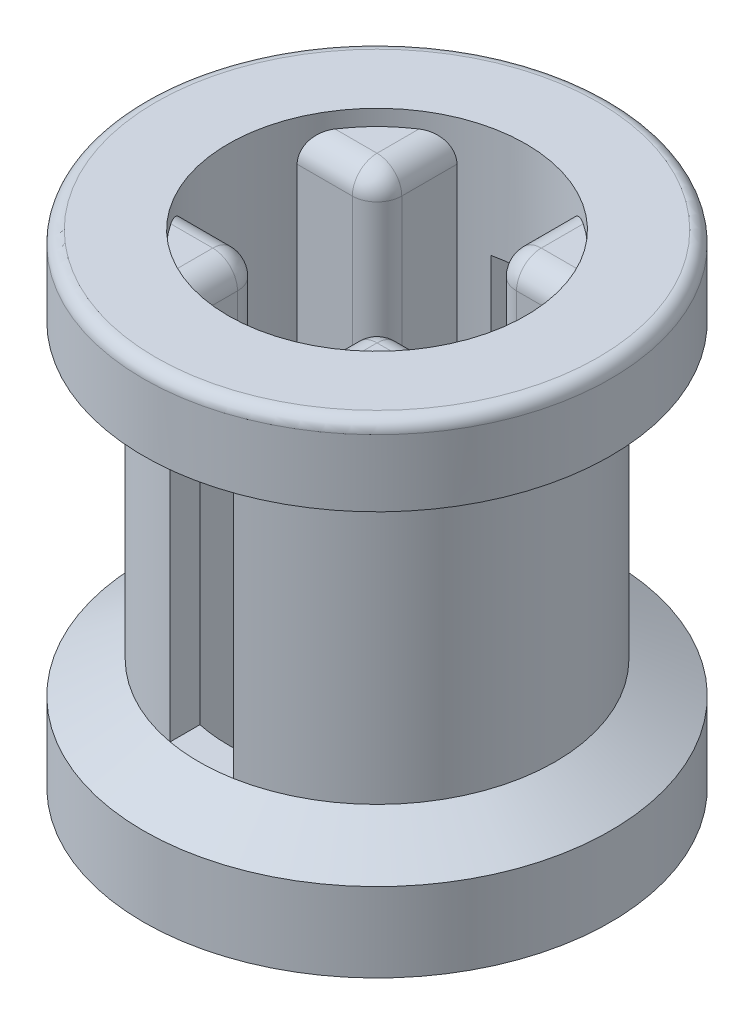
from build123d import *
from build123d.topology import SkipClean

# Parameters (mm, degrees)
SKETCH2_R                = 2.3876
CUT_EXTRUDE1_DEPTH       = 10.385549185
FILLET1_R                = 0.1984375
CUT_EXTRUDE2_DEPTH       = 10.385549265
CUT_EXTRUDE2_DEPTH_BACK  = 10.385549265
SKETCH3_W                = 1.016
SKETCH3_H                = 4.18947027
BOSS_EXTRUDE1_DEPTH      = 7.747
FILLET2_R                = 0.396875
CIRPATTERN1_COUNT        = 4
FILLET2_OF_CIRPATTERN1_R = 0.396875
SKETCH5_R                = 2.3876
CUT_EXTRUDE3_DEPTH       = 0.254
CUT_EXTRUDE4_START       = -0.254
SKETCH6_R                = 2.3876
CUT_EXTRUDE4_DEPTH       = 0.254
FILLET3_R                = 0.396875


with BuildPart() as part:
    # Sketch1 → Base-Revolve (revolve)
    with BuildSketch(Plane.XY, mode=Mode.PRIVATE) as base_revolve_sk:
        Polygon((0, 7.747), (3.7465, 7.747), (3.7465, 6.477), (2.8575, 5.963735611), (2.8575, 1.783264389), (3.7465, 1.27), (3.7465, 0), (0, 0), align=None)
    revolve(base_revolve_sk.sketch.rotate(Axis((0, 0, 0), (0, 1, 0)), 90), axis=Axis((0, 0, 0), (0, 1, 0)))

    # Sketch2 → Cut-Extrude1 (cut, through all)
    with BuildSketch(Plane(origin=(0, 7.747, 0), x_dir=(-1, 0, 0), z_dir=(0, 1, 0))):
        with Locations(Location((0, 0, 0), (0, 0, 90))):
            Circle(SKETCH2_R)
    extrude(amount=-CUT_EXTRUDE1_DEPTH, mode=Mode.SUBTRACT)

    # Fillet1
    fillet1_edges = [part.edges().sort_by_distance(p)[0] for p in [
        (0, 7.747, 3.7465),
    ]]
    fillet(fillet1_edges, radius=FILLET1_R)

    # Sketch3 → Cut-Extrude2 (cut, two sides: drawn at the far end of the back side and taken through both)
    with BuildSketch(Plane.XY.offset(-CUT_EXTRUDE2_DEPTH_BACK)):
        with Locations((0, 3.877999524)):
            Rectangle(SKETCH3_W, SKETCH3_H)
    extrude(amount=CUT_EXTRUDE2_DEPTH + CUT_EXTRUDE2_DEPTH_BACK, mode=Mode.SUBTRACT)

    # Sketch4 → Boss-Extrude1 (add, through all)
    with BuildSketch(Plane(origin=(0, 7.747, 0), x_dir=(-1, 0, 0), z_dir=(0, 1, 0))):
        with BuildLine():
            Line((2.202919244, -0.92075), (0.92075, -0.92075))
            Line((0.92075, -0.92075), (0.92075, -2.202919244))
            ThreePointArc((0.92075, -2.202919244), (1.688288151, -1.688288151), (2.202919244, -0.92075))
        make_face()
    boss_extrude1 = extrude(amount=-BOSS_EXTRUDE1_DEPTH)

    # Fillet2
    fillet2_edges = [part.edges().sort_by_distance(p)[0] for p in [
        (-0.92075, 3.8735, -0.92075),
    ]]
    fillet(fillet2_edges, radius=FILLET2_R)

    # CirPattern1: Boss-Extrude1 ×4 about axis
    cirpattern1_axis = Axis((0, 0, 0), (0, 1, 0))
    for i in range(1, CIRPATTERN1_COUNT):
        add(boss_extrude1.rotate(cirpattern1_axis, i * 360 / CIRPATTERN1_COUNT))

    # Fillet2 of CirPattern1
    fillet2_of_cirpattern1_edges = [part.edges().sort_by_distance(p)[0] for p in [
        (-0.92075, 3.8735, 0.92075),
        (0.92075, 3.8735, 0.92075),
        (0.92075, 3.8735, -0.92075),
    ]]
    fillet(fillet2_of_cirpattern1_edges, radius=FILLET2_OF_CIRPATTERN1_R)

    # Sketch5 → Cut-Extrude3 (cut)
    with SkipClean():  # the faces are left unmerged after this step: merging them gives an invalid solid
        with BuildSketch(Plane(origin=(0, 7.747, 0), x_dir=(-1, 0, 0), z_dir=(0, 1, 0))):
            with Locations(Location((0, 0, 0), (0, 0, 90))):
                Circle(SKETCH5_R)
        extrude(amount=-CUT_EXTRUDE3_DEPTH, mode=Mode.SUBTRACT)
    add(part.part.scale(1), mode=Mode.REPLACE)  # the faces are merged on a copy

    # Sketch6 → Cut-Extrude4 (cut)
    with BuildSketch(Plane.XZ.offset(CUT_EXTRUDE4_START)):
        with Locations(Location((0, 0, 0), (0, 0, 90))):
            Circle(SKETCH6_R)
    extrude(amount=CUT_EXTRUDE4_DEPTH, mode=Mode.SUBTRACT)

    # Fillet3
    # the kernel refuses this fillet: 0.396875 mm, written as the material it takes off along each edge
    with BuildSketch(Plane(origin=(-1.317625, 7.493, 1.317625), x_dir=(0, 0, -1), z_dir=(-1, 0, 0))) as fillet3_piece_1:
        with BuildLine():
            CenterArc((0.396875 - FILLET3_R, FILLET3_R), FILLET3_R, 270, 90)
            Line((0.396875, FILLET3_R), (0.396875, 0))
            Line((0.396875, 0), (0.396875 - FILLET3_R, 0))
        make_face()
    revolve(axis=Axis((-1.317625, 7.493, 1.317625), (0, -1, 0)), revolution_arc=90, mode=Mode.SUBTRACT)
    with BuildSketch(Plane(origin=(-0.92075, 7.493, -3.195106744), x_dir=(-1, 0, 0), z_dir=(0, 0, 1))) as fillet3_piece_2_section:
        with BuildLine():
            CenterArc((FILLET3_R, FILLET3_R), FILLET3_R, 180, 90)
            Line((0, FILLET3_R), (0, 0))
            Line((0, 0), (FILLET3_R, 0))
        make_face()
    fillet3_piece_2 = extrude(amount=1.877481744, mode=Mode.PRIVATE)
    fillet3_piece_2 = fillet3_piece_2 & Plane(origin=(0, 7.394842615, 0), x_dir=(0, 0, 1), z_dir=(0, 1, 0)) * Cylinder(2.3876, 6, mode=Mode.PRIVATE)
    add(fillet3_piece_2, mode=Mode.SUBTRACT)
    with BuildSketch(Plane(origin=(-1.317625, 7.493, -1.317625), x_dir=(1, 0, 0), z_dir=(0, 0, -1))) as fillet3_piece_3:
        with BuildLine():
            CenterArc((0.396875 - FILLET3_R, FILLET3_R), FILLET3_R, 270, 90)
            Line((0.396875, FILLET3_R), (0.396875, 0))
            Line((0.396875, 0), (0.396875 - FILLET3_R, 0))
        make_face()
    revolve(axis=Axis((-1.317625, 7.493, -1.317625), (0, -1, 0)), revolution_arc=90, mode=Mode.SUBTRACT)
    with BuildSketch(Plane(origin=(-1.317625, 7.493, -0.92075), x_dir=(0, 0, -1), z_dir=(-1, 0, 0))) as fillet3_piece_4_section:
        with BuildLine():
            CenterArc((FILLET3_R, FILLET3_R), FILLET3_R, 180, 90)
            Line((0, FILLET3_R), (0, 0))
            Line((0, 0), (FILLET3_R, 0))
        make_face()
    fillet3_piece_4 = extrude(amount=1.877481744, mode=Mode.PRIVATE)
    fillet3_piece_4 = fillet3_piece_4 & Plane(origin=(0, 7.424286549, 0), x_dir=(0, 0, 1), z_dir=(0, 1, 0)) * Cylinder(2.3876, 6, mode=Mode.PRIVATE)
    add(fillet3_piece_4, mode=Mode.SUBTRACT)
    with BuildSketch(Plane(origin=(3.195106744, 7.493, -0.92075), x_dir=(0, 0, -1), z_dir=(-1, 0, 0))) as fillet3_piece_5_section:
        with BuildLine():
            CenterArc((FILLET3_R, FILLET3_R), FILLET3_R, 180, 90)
            Line((0, FILLET3_R), (0, 0))
            Line((0, 0), (FILLET3_R, 0))
        make_face()
    fillet3_piece_5 = extrude(amount=1.877481744, mode=Mode.PRIVATE)
    fillet3_piece_5 = fillet3_piece_5 & Plane(origin=(0, 7.394842615, 0), x_dir=(0, 0, 1), z_dir=(0, 1, 0)) * Cylinder(2.3876, 6, mode=Mode.PRIVATE)
    add(fillet3_piece_5, mode=Mode.SUBTRACT)
    with BuildSketch(Plane(origin=(1.317625, 7.493, -1.317625), x_dir=(0, 0, 1), z_dir=(1, 0, 0))) as fillet3_piece_6:
        with BuildLine():
            CenterArc((0.396875 - FILLET3_R, FILLET3_R), FILLET3_R, 270, 90)
            Line((0.396875, FILLET3_R), (0.396875, 0))
            Line((0.396875, 0), (0.396875 - FILLET3_R, 0))
        make_face()
    revolve(axis=Axis((1.317625, 7.493, -1.317625), (0, -1, 0)), revolution_arc=90, mode=Mode.SUBTRACT)
    with BuildSketch(Plane(origin=(0.92075, 7.493, -1.317625), x_dir=(1, 0, 0), z_dir=(0, 0, -1))) as fillet3_piece_7_section:
        with BuildLine():
            CenterArc((FILLET3_R, FILLET3_R), FILLET3_R, 180, 90)
            Line((0, FILLET3_R), (0, 0))
            Line((0, 0), (FILLET3_R, 0))
        make_face()
    fillet3_piece_7 = extrude(amount=1.877481744, mode=Mode.PRIVATE)
    fillet3_piece_7 = fillet3_piece_7 & Plane(origin=(0, 7.424286549, 0), x_dir=(0, 0, 1), z_dir=(0, 1, 0)) * Cylinder(2.3876, 6, mode=Mode.PRIVATE)
    add(fillet3_piece_7, mode=Mode.SUBTRACT)
    with BuildSketch(Plane(origin=(0.92075, 7.493, 3.195106744), x_dir=(0, -1, 0), z_dir=(0, 0, -1))) as fillet3_piece_8_section:
        with BuildLine():
            CenterArc((FILLET3_R, -FILLET3_R), FILLET3_R, 90, 90)
            Line((0, -FILLET3_R), (0, 0))
            Line((0, 0), (FILLET3_R, 0))
        make_face()
    fillet3_piece_8 = extrude(amount=1.877481744, mode=Mode.PRIVATE)
    fillet3_piece_8 = fillet3_piece_8 & Plane(origin=(0, 7.394842607, 0), x_dir=(0, 0, 1), z_dir=(0, 1, 0)) * Cylinder(2.3876, 6, mode=Mode.PRIVATE)
    add(fillet3_piece_8, mode=Mode.SUBTRACT)
    with BuildSketch(Plane(origin=(1.317625, 7.493, 1.317625), x_dir=(-1, 0, 0), z_dir=(0, 0, 1))) as fillet3_piece_9:
        with BuildLine():
            CenterArc((0.396875 - FILLET3_R, FILLET3_R), FILLET3_R, 270, 90)
            Line((0.396875 - FILLET3_R, 0), (0.396875, 0))
            Line((0.396875, 0), (0.396875, FILLET3_R))
        make_face()
    revolve(axis=Axis((1.317625, 7.493, 1.317625), (0, -1, 0)), revolution_arc=90, mode=Mode.SUBTRACT)
    with BuildSketch(Plane(origin=(1.317625, 7.493, 0.92075), x_dir=(0, -1, 0), z_dir=(1, 0, 0))) as fillet3_piece_10_section:
        with BuildLine():
            CenterArc((FILLET3_R, -FILLET3_R), FILLET3_R, 90, 90)
            Line((0, -FILLET3_R), (0, 0))
            Line((0, 0), (FILLET3_R, 0))
        make_face()
    fillet3_piece_10 = extrude(amount=1.877481744, mode=Mode.PRIVATE)
    fillet3_piece_10 = fillet3_piece_10 & Plane(origin=(0, 7.394842626, 0), x_dir=(0, 0, 1), z_dir=(0, 1, 0)) * Cylinder(2.3876, 6, mode=Mode.PRIVATE)
    add(fillet3_piece_10, mode=Mode.SUBTRACT)
    with BuildSketch(Plane(origin=(-3.195106744, 7.493, 0.92075), x_dir=(0, 0, 1), z_dir=(1, 0, 0))) as fillet3_piece_11_section:
        with BuildLine():
            CenterArc((FILLET3_R, FILLET3_R), FILLET3_R, 180, 90)
            Line((0, FILLET3_R), (0, 0))
            Line((0, 0), (FILLET3_R, 0))
        make_face()
    fillet3_piece_11 = extrude(amount=1.877481744, mode=Mode.PRIVATE)
    fillet3_piece_11 = fillet3_piece_11 & Plane(origin=(0, 7.394842615, 0), x_dir=(0, 0, 1), z_dir=(0, 1, 0)) * Cylinder(2.3876, 6, mode=Mode.PRIVATE)
    add(fillet3_piece_11, mode=Mode.SUBTRACT)
    with BuildSketch(Plane(origin=(-0.92075, 7.493, 1.317625), x_dir=(-1, 0, 0), z_dir=(0, 0, 1))) as fillet3_piece_12_section:
        with BuildLine():
            CenterArc((FILLET3_R, FILLET3_R), FILLET3_R, 180, 90)
            Line((0, FILLET3_R), (0, 0))
            Line((0, 0), (FILLET3_R, 0))
        make_face()
    fillet3_piece_12 = extrude(amount=1.877481744, mode=Mode.PRIVATE)
    fillet3_piece_12 = fillet3_piece_12 & Plane(origin=(0, 7.424286549, 0), x_dir=(0, 0, 1), z_dir=(0, 1, 0)) * Cylinder(2.3876, 6, mode=Mode.PRIVATE)
    add(fillet3_piece_12, mode=Mode.SUBTRACT)
    with BuildSketch(Plane(origin=(-1.317625, 0.254, -1.317625), x_dir=(1, 0, 0), z_dir=(0, 0, -1))) as fillet3_piece_13:
        with BuildLine():
            CenterArc((0.396875 - FILLET3_R, -FILLET3_R), FILLET3_R, 0, 90)
            Line((0.396875 - FILLET3_R, 0), (0.396875, 0))
            Line((0.396875, 0), (0.396875, -FILLET3_R))
        make_face()
    revolve(axis=Axis((-1.317625, 0.254, -1.317625), (0, -1, 0)), revolution_arc=90, mode=Mode.SUBTRACT)
    with BuildSketch(Plane(origin=(-0.92075, 0.254, -1.317625), x_dir=(0, 1, 0), z_dir=(0, 0, -1))) as fillet3_piece_14_section:
        with BuildLine():
            CenterArc((FILLET3_R, -FILLET3_R), FILLET3_R, 90, 90)
            Line((0, -FILLET3_R), (0, 0))
            Line((0, 0), (FILLET3_R, 0))
        make_face()
    fillet3_piece_14 = extrude(amount=1.877481744, mode=Mode.PRIVATE)
    fillet3_piece_14 = fillet3_piece_14 & Plane(origin=(0, 0.352157392, 0), x_dir=(0, 0, 1), z_dir=(0, 1, 0)) * Cylinder(2.3876, 6, mode=Mode.PRIVATE)
    add(fillet3_piece_14, mode=Mode.SUBTRACT)
    with BuildSketch(Plane(origin=(-3.195106744, 0.254, -0.92075), x_dir=(0, 0, -1), z_dir=(1, 0, 0))) as fillet3_piece_15_section:
        with BuildLine():
            CenterArc((FILLET3_R, FILLET3_R), FILLET3_R, 180, 90)
            Line((0, FILLET3_R), (0, 0))
            Line((0, 0), (FILLET3_R, 0))
        make_face()
    fillet3_piece_15 = extrude(amount=1.877481744, mode=Mode.PRIVATE)
    fillet3_piece_15 = fillet3_piece_15 & Plane(origin=(0, 0.352157373, 0), x_dir=(0, 0, 1), z_dir=(0, 1, 0)) * Cylinder(2.3876, 6, mode=Mode.PRIVATE)
    add(fillet3_piece_15, mode=Mode.SUBTRACT)
    with BuildSketch(Plane(origin=(1.317625, 0.254, -1.317625), x_dir=(0, 0, 1), z_dir=(1, 0, 0))) as fillet3_piece_16:
        with BuildLine():
            CenterArc((0.396875 - FILLET3_R, -FILLET3_R), FILLET3_R, 0, 90)
            Line((0.396875 - FILLET3_R, 0), (0.396875, 0))
            Line((0.396875, 0), (0.396875, -FILLET3_R))
        make_face()
    revolve(axis=Axis((1.317625, 0.254, -1.317625), (0, -1, 0)), revolution_arc=90, mode=Mode.SUBTRACT)
    with BuildSketch(Plane(origin=(1.317625, 0.254, -0.92075), x_dir=(0, 1, 0), z_dir=(1, 0, 0))) as fillet3_piece_17_section:
        with BuildLine():
            CenterArc((FILLET3_R, -FILLET3_R), FILLET3_R, 90, 90)
            Line((0, -FILLET3_R), (0, 0))
            Line((0, 0), (FILLET3_R, 0))
        make_face()
    fillet3_piece_17 = extrude(amount=1.877481744, mode=Mode.PRIVATE)
    fillet3_piece_17 = fillet3_piece_17 & Plane(origin=(0, 0.352157392, 0), x_dir=(0, 0, 1), z_dir=(0, 1, 0)) * Cylinder(2.3876, 6, mode=Mode.PRIVATE)
    add(fillet3_piece_17, mode=Mode.SUBTRACT)
    with BuildSketch(Plane(origin=(0.92075, 0.254, -3.195106744), x_dir=(1, 0, 0), z_dir=(0, 0, 1))) as fillet3_piece_18_section:
        with BuildLine():
            CenterArc((FILLET3_R, FILLET3_R), FILLET3_R, 180, 90)
            Line((0, FILLET3_R), (0, 0))
            Line((0, 0), (FILLET3_R, 0))
        make_face()
    fillet3_piece_18 = extrude(amount=1.877481744, mode=Mode.PRIVATE)
    fillet3_piece_18 = fillet3_piece_18 & Plane(origin=(0, 0.352157373, 0), x_dir=(0, 0, 1), z_dir=(0, 1, 0)) * Cylinder(2.3876, 6, mode=Mode.PRIVATE)
    add(fillet3_piece_18, mode=Mode.SUBTRACT)
    with BuildSketch(Plane(origin=(1.317625, 0.254, 1.317625), x_dir=(-1, 0, 0), z_dir=(0, 0, 1))) as fillet3_piece_19:
        with BuildLine():
            CenterArc((0.396875 - FILLET3_R, -FILLET3_R), FILLET3_R, 0, 90)
            Line((0.396875 - FILLET3_R, 0), (0.396875, 0))
            Line((0.396875, 0), (0.396875, -FILLET3_R))
        make_face()
    revolve(axis=Axis((1.317625, 0.254, 1.317625), (0, -1, 0)), revolution_arc=90, mode=Mode.SUBTRACT)
    with BuildSketch(Plane(origin=(0.92075, 0.254, 1.317625), x_dir=(0, 1, 0), z_dir=(0, 0, 1))) as fillet3_piece_20_section:
        with BuildLine():
            CenterArc((FILLET3_R, -FILLET3_R), FILLET3_R, 90, 90)
            Line((0, -FILLET3_R), (0, 0))
            Line((0, 0), (FILLET3_R, 0))
        make_face()
    fillet3_piece_20 = extrude(amount=1.877481744, mode=Mode.PRIVATE)
    fillet3_piece_20 = fillet3_piece_20 & Plane(origin=(0, 0.352157393, 0), x_dir=(0, 0, 1), z_dir=(0, 1, 0)) * Cylinder(2.3876, 6, mode=Mode.PRIVATE)
    add(fillet3_piece_20, mode=Mode.SUBTRACT)
    with BuildSketch(Plane(origin=(3.195106744, 0.254, 0.92075), x_dir=(0, 0, 1), z_dir=(-1, 0, 0))) as fillet3_piece_21_section:
        with BuildLine():
            CenterArc((FILLET3_R, FILLET3_R), FILLET3_R, 180, 90)
            Line((0, FILLET3_R), (0, 0))
            Line((0, 0), (FILLET3_R, 0))
        make_face()
    fillet3_piece_21 = extrude(amount=1.877481744, mode=Mode.PRIVATE)
    fillet3_piece_21 = fillet3_piece_21 & Plane(origin=(0, 0.352157373, 0), x_dir=(0, 0, 1), z_dir=(0, 1, 0)) * Cylinder(2.3876, 6, mode=Mode.PRIVATE)
    add(fillet3_piece_21, mode=Mode.SUBTRACT)
    with BuildSketch(Plane(origin=(-1.317625, 0.254, 1.317625), x_dir=(0, 0, -1), z_dir=(-1, 0, 0))) as fillet3_piece_22:
        with BuildLine():
            CenterArc((0.396875 - FILLET3_R, -FILLET3_R), FILLET3_R, 0, 90)
            Line((0.396875 - FILLET3_R, 0), (0.396875, 0))
            Line((0.396875, 0), (0.396875, -FILLET3_R))
        make_face()
    revolve(axis=Axis((-1.317625, 0.254, 1.317625), (0, -1, 0)), revolution_arc=90, mode=Mode.SUBTRACT)
    with BuildSketch(Plane(origin=(-1.317625, 0.254, 0.92075), x_dir=(0, 1, 0), z_dir=(-1, 0, 0))) as fillet3_piece_23_section:
        with BuildLine():
            CenterArc((FILLET3_R, -FILLET3_R), FILLET3_R, 90, 90)
            Line((0, -FILLET3_R), (0, 0))
            Line((0, 0), (FILLET3_R, 0))
        make_face()
    fillet3_piece_23 = extrude(amount=1.877481744, mode=Mode.PRIVATE)
    fillet3_piece_23 = fillet3_piece_23 & Plane(origin=(0, 0.352157393, 0), x_dir=(0, 0, 1), z_dir=(0, 1, 0)) * Cylinder(2.3876, 6, mode=Mode.PRIVATE)
    add(fillet3_piece_23, mode=Mode.SUBTRACT)
    with BuildSketch(Plane(origin=(-0.92075, 0.254, 3.195106744), x_dir=(-1, 0, 0), z_dir=(0, 0, -1))) as fillet3_piece_24_section:
        with BuildLine():
            CenterArc((FILLET3_R, FILLET3_R), FILLET3_R, 180, 90)
            Line((0, FILLET3_R), (0, 0))
            Line((0, 0), (FILLET3_R, 0))
        make_face()
    fillet3_piece_24 = extrude(amount=1.877481744, mode=Mode.PRIVATE)
    fillet3_piece_24 = fillet3_piece_24 & Plane(origin=(0, 0.352157373, 0), x_dir=(0, 0, 1), z_dir=(0, 1, 0)) * Cylinder(2.3876, 6, mode=Mode.PRIVATE)
    add(fillet3_piece_24, mode=Mode.SUBTRACT)


solid = part.part
